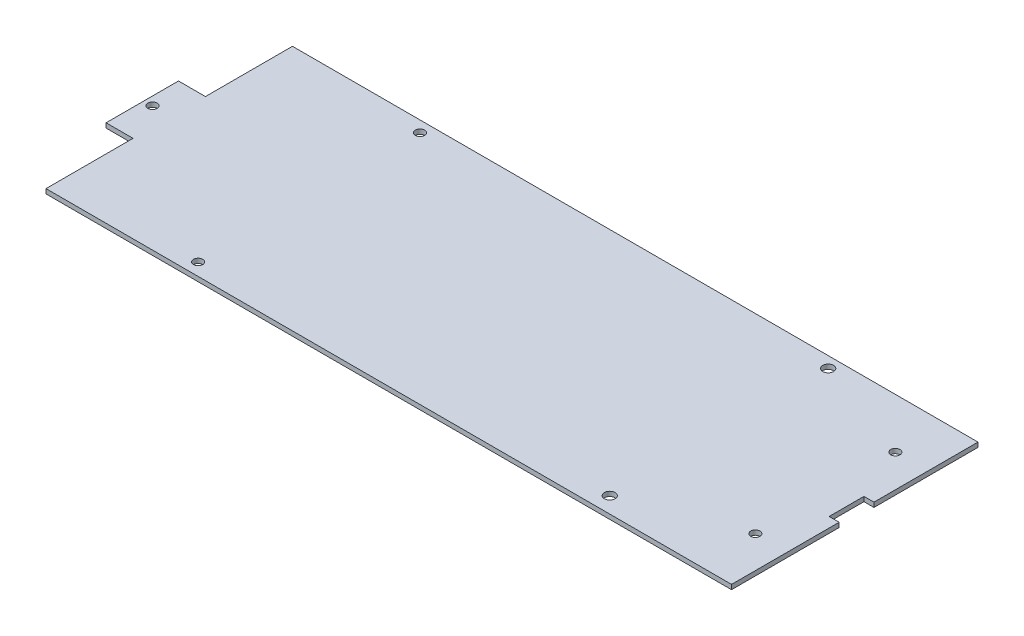
from build123d import *

# Parameters (mm, degrees)
BOSS_EXTRUDE1_START = 2
SKETCH1_R           = 3
SKETCH1_R_2         = 3.5
BOSS_EXTRUDE1_DEPTH = 3


with BuildPart() as part:
    # Sketch1 → Boss-Extrude1 (new body)
    with BuildSketch(Plane(origin=(0, 0, 0), x_dir=(1, 0, 0), z_dir=(0, 1, 0)).offset(BOSS_EXTRUDE1_START)):
        Polygon((-284.735528935, 23.500019566), (-302.235528935, 23.500019566), (-302.235528935, -23.499980434), (-284.735528935, -23.499980434), (-284.735528935, -79.999980434), (160.264471065, -79.999980434), (160.264471065, -10.137889021), (153.764471065, -10.137889021), (153.764471065, 12.462110979), (160.264471065, 12.462110979), (160.264471065, 80.000019566), (-284.735528935, 80.000019566), align=None)
        with Locations((-194.126526137, -71.865769187)):
            Circle(SKETCH1_R, mode=Mode.SUBTRACT)
        with Locations((70.864078067, -69.634248819)):
            Circle(SKETCH1_R_2, mode=Mode.SUBTRACT)
        with Locations((139.486711961, -43.781864163)):
            Circle(SKETCH1_R, mode=Mode.SUBTRACT)
        with Locations((-296.74646616, 1.162110979)):
            Circle(SKETCH1_R, mode=Mode.SUBTRACT)
        with Locations((-194.735528935, 72.773627962)):
            Circle(SKETCH1_R, mode=Mode.SUBTRACT)
        with Locations((139.102370463, 47.500019566)):
            Circle(SKETCH1_R, mode=Mode.SUBTRACT)
        with Locations((70.264471065, 72.773627962)):
            Circle(SKETCH1_R_2, mode=Mode.SUBTRACT)
    extrude(amount=BOSS_EXTRUDE1_DEPTH)


solid = part.part
